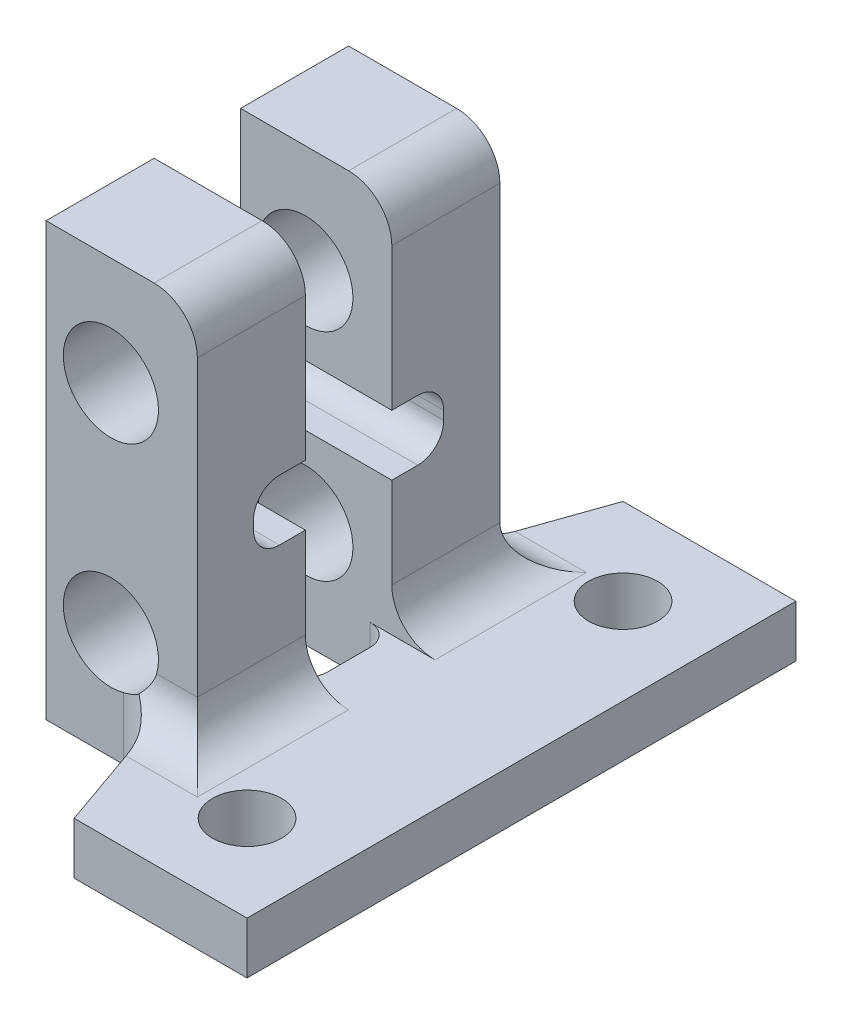
from build123d import *

# Parameters (mm, degrees)
SALIENTE_EXTRUIR1_DEPTH = 5
SALIENTE_EXTRUIR2_DEPTH = 10
SALIENTE_EXTRUIR3_DEPTH = 2
CORTAR_EXTRUIR1_START   = 7
CROQUIS2_R              = 2.2
CORTAR_EXTRUIR1_DEPTH   = 14
CROQUIS3_R              = 1.6
CROQUIS3_W              = 5
CROQUIS3_H              = 4
CROQUIS3_W_2            = 2
CORTAR_EXTRUIR2_DEPTH   = 2.4
REDONDEO1_R             = 2
REDONDEO2_R             = 2
REDONDEO3_R             = 1
REDONDEO4_R             = 1.2


with BuildPart() as part:
    # Croquis1 → Saliente-Extruir1 (new body)
    with BuildSketch(Plane(origin=(0, 0, 0), x_dir=(0, 0, -1), z_dir=(1, 0, 0))):
        Polygon((-12.7, 2.4), (-12.7, 0), (12.7, 0), (12.7, 2.4), (7, 2.4), (7, 20), (2, 20), (2, 11.4), (4.4, 11.4), (4.4, 8.6), (2, 8.6), (2, 2.4), (-2, 2.4), (-2, 8.6), (-4.4, 8.6), (-4.4, 11.4), (-2, 11.4), (-2, 20), (-7, 20), (-7, 2.4), align=None)
    extrude(amount=-SALIENTE_EXTRUIR1_DEPTH)

    # Croquis1<3> → Saliente-Extruir2 (add)
    with BuildSketch(Plane(origin=(0, 0, 0), x_dir=(0, 0, -1), z_dir=(1, 0, 0))):
        Polygon((2, 2.4), (7, 2.4), (12.7, 2.4), (12.7, 0), (-12.7, 0), (-12.7, 2.4), (-7, 2.4), (-2, 2.4), align=None)
    extrude(amount=SALIENTE_EXTRUIR2_DEPTH)

    # Croquis1<4> → Saliente-Extruir3 (add)
    with BuildSketch(Plane(origin=(0, 0, 0), x_dir=(0, 0, -1), z_dir=(1, 0, 0))):
        Polygon((-7, 20), (-7, 2.4), (-2, 2.4), (-2, 8.6), (-4.4, 8.6), (-4.4, 11.4), (-2, 11.4), (-2, 20), align=None)
        Polygon((2, 2.4), (7, 2.4), (7, 20), (2, 20), (2, 11.4), (4.4, 11.4), (4.4, 8.6), (2, 8.6), align=None)
    extrude(amount=SALIENTE_EXTRUIR3_DEPTH)

    # Croquis2 → Cortar-Extruir1 (cut)
    with BuildSketch(Plane.XY.offset(CORTAR_EXTRUIR1_START)):
        with Locations(Location((-2, 15, 0), (0, 0, 270))):
            Circle(CROQUIS2_R)
        with Locations(Location((-2, 5, 0), (0, 0, 270))):
            Circle(CROQUIS2_R)
    extrude(amount=-CORTAR_EXTRUIR1_DEPTH, mode=Mode.SUBTRACT)

    # Croquis3 → Cortar-Extruir2 (cut)
    with BuildSketch(Plane(origin=(0, 0, 0), x_dir=(1, 0, 0), z_dir=(0, 1, 0))):
        Polygon((-5, 7), (0, 7), (2, 12.7), (-5, 12.7), align=None)
        Polygon((2, -12.7), (0, -7), (-5, -7), (-5, -12.7), align=None)
        with Locations(Location((6, -8.7, 0), (0, 0, 90))):
            Circle(CROQUIS3_R)
        with Locations(Location((6, 8.7, 0), (0, 0, 90))):
            Circle(CROQUIS3_R)
        with Locations((-2.5, 0)):
            Rectangle(CROQUIS3_W, CROQUIS3_H)
        with Locations((1, 0)):
            Rectangle(CROQUIS3_W_2, CROQUIS3_H)
    extrude(amount=CORTAR_EXTRUIR2_DEPTH, mode=Mode.SUBTRACT)

    # Redondeo1
    redondeo1_edges = [part.edges().sort_by_distance(p)[0] for p in [
        (2, 20, -4.5),
        (2, 20, 4.5),
    ]]
    fillet(redondeo1_edges, radius=REDONDEO1_R)

    # Redondeo2
    # the kernel refuses this fillet: 2 mm, written as the material it adds along each edge
    with BuildSketch(Plane(origin=(2, 2.4, 3), x_dir=(1, 0, 0), z_dir=(0, 0, -1))) as redondeo2_piece_1_section:
        with BuildLine():
            CenterArc((REDONDEO2_R, -REDONDEO2_R), REDONDEO2_R, 90, 90)
            Line((0, -REDONDEO2_R), (0, 0))
            Line((0, 0), (REDONDEO2_R, 0))
        make_face()
    redondeo2_piece_1 = extrude(amount=15, mode=Mode.PRIVATE)
    redondeo2_piece_1 = split(redondeo2_piece_1, bisect_by=Plane(origin=(2, 2.4, 2), z_dir=(0, 0, 1)), keep=Keep.TOP, mode=Mode.PRIVATE)
    add(redondeo2_piece_1)
    with BuildSketch(Plane(origin=(2, 2.4, -2), x_dir=(1, 0, 0), z_dir=(0, 0, -1))) as redondeo2_piece_2:
        with BuildLine():
            CenterArc((REDONDEO2_R, -REDONDEO2_R), REDONDEO2_R, 90, 90)
            Line((0, -REDONDEO2_R), (0, 0))
            Line((0, 0), (REDONDEO2_R, 0))
        make_face()
    extrude(amount=5)
    with BuildSketch(Plane(origin=(-5, 2.4, -7), x_dir=(0, 0, -1), z_dir=(1, 0, 0))) as redondeo2_piece_3_section:
        with BuildLine():
            CenterArc((REDONDEO2_R, REDONDEO2_R), REDONDEO2_R, 180, 90)
            Line((0, REDONDEO2_R), (0, 0))
            Line((0, 0), (REDONDEO2_R, 0))
        make_face()
    redondeo2_piece_3 = extrude(amount=7, mode=Mode.PRIVATE)
    redondeo2_piece_3 = split(redondeo2_piece_3, bisect_by=Plane(origin=(-0.548095369, 2.4, -5.4379282), z_dir=(0.9435999821328808, 0, 0.331087713029081)), keep=Keep.TOP, mode=Mode.PRIVATE)
    redondeo2_piece_3 = redondeo2_piece_3 - Plane(origin=(-2, 5, -7), x_dir=(0, -1, 0), z_dir=(0, 0, 1)) * Cylinder(2.2, 22, mode=Mode.PRIVATE)
    add(redondeo2_piece_3)
    with BuildSketch(Plane(origin=(2, 2.4, 7), x_dir=(0, 1, 0), z_dir=(-1, 0, 0))) as redondeo2_piece_4_section:
        with BuildLine():
            CenterArc((REDONDEO2_R, -REDONDEO2_R), REDONDEO2_R, 90, 90)
            Line((0, -REDONDEO2_R), (0, 0))
            Line((0, 0), (REDONDEO2_R, 0))
        make_face()
    redondeo2_piece_4 = extrude(amount=7, mode=Mode.PRIVATE)
    redondeo2_piece_4 = split(redondeo2_piece_4, bisect_by=Plane(origin=(0.219238147, 2.4, 7.62482872), z_dir=(0.9435999821328808, 0, -0.331087713029081)), keep=Keep.TOP, mode=Mode.PRIVATE)
    redondeo2_piece_4 = redondeo2_piece_4 - Plane(origin=(-2, 5, 7), x_dir=(0, -1, 0), z_dir=(0, 0, 1)) * Cylinder(2.2, 22, mode=Mode.PRIVATE)
    add(redondeo2_piece_4)
    with BuildSketch(Plane(origin=(0, 0, 7), x_dir=(-1, 0, 0), z_dir=(0, 1, 0))) as redondeo2_piece_5:
        with BuildLine():
            CenterArc((REDONDEO2_R * 0.708893916529, REDONDEO2_R), REDONDEO2_R, 199.334808538, 70.665191462)
            Line((-REDONDEO2_R * 0.234706065604, REDONDEO2_R * 0.668912286971), (0, 0))
            Line((0, 0), (REDONDEO2_R * 0.708893916529, 0))
        make_face()
    extrude(amount=2.4)
    with BuildSketch(Plane(origin=(0, 0, -7), x_dir=(-1, 0, 0), z_dir=(0, 1, 0))) as redondeo2_piece_6:
        with BuildLine():
            CenterArc((REDONDEO2_R * 0.708893916529, -REDONDEO2_R), REDONDEO2_R, 90, 70.665191462)
            Line((-REDONDEO2_R * 0.234706065604, -REDONDEO2_R * 0.668912286971), (0, 0))
            Line((0, 0), (REDONDEO2_R * 0.708893916529, 0))
        make_face()
    extrude(amount=2.4)
    with BuildSketch(Plane(origin=(2, 2.4, 7), x_dir=(0, 1, 0), z_dir=(0, 0, -1))) as redondeo2_piece_7:
        with BuildLine():
            CenterArc((REDONDEO2_R, REDONDEO2_R), REDONDEO2_R, 180, 90)
            Line((0, REDONDEO2_R), (0, 0))
            Line((0, 0), (REDONDEO2_R, 0))
        make_face()
    extrude(amount=5)
    with BuildSketch(Plane(origin=(2, 2.4, 12), x_dir=(0, 1, 0), z_dir=(0, 0, -1))) as redondeo2_piece_8_section:
        with BuildLine():
            CenterArc((REDONDEO2_R, REDONDEO2_R), REDONDEO2_R, 180, 90)
            Line((0, REDONDEO2_R), (0, 0))
            Line((0, 0), (REDONDEO2_R, 0))
        make_face()
    redondeo2_piece_8 = extrude(amount=15, mode=Mode.PRIVATE)
    redondeo2_piece_8 = split(redondeo2_piece_8, bisect_by=Plane(origin=(2, 2.4, -2), z_dir=(0, 0, -1)), keep=Keep.TOP, mode=Mode.PRIVATE)
    add(redondeo2_piece_8)
    with BuildSketch(Plane(origin=(2, 2.4, -2), x_dir=(1, 0, 0), z_dir=(0, 0, -1))) as redondeo2_piece_9a_section:
        with BuildLine():
            CenterArc((REDONDEO2_R, -REDONDEO2_R), REDONDEO2_R, 90, 90)
            Line((0, -REDONDEO2_R), (0, 0))
            Line((0, 0), (REDONDEO2_R, 0))
        make_face()
    redondeo2_piece_9a = extrude(amount=10, mode=Mode.PRIVATE)
    redondeo2_piece_9a = split(redondeo2_piece_9a, bisect_by=Plane(origin=(2, 2.4, -7), z_dir=(0, 0, -1)), keep=Keep.TOP, mode=Mode.PRIVATE)
    with BuildSketch(Plane(origin=(-5, 2.4, -7), x_dir=(0, 0, -1), z_dir=(1, 0, 0))) as redondeo2_piece_9b_section:
        with BuildLine():
            CenterArc((REDONDEO2_R, REDONDEO2_R), REDONDEO2_R, 180, 90)
            Line((0, REDONDEO2_R), (0, 0))
            Line((0, 0), (REDONDEO2_R, 0))
        make_face()
    redondeo2_piece_9b = extrude(amount=12, mode=Mode.PRIVATE)
    redondeo2_piece_9b = split(redondeo2_piece_9b, bisect_by=Plane(origin=(2, 2.4, -7), z_dir=(1, 0, 0)), keep=Keep.TOP, mode=Mode.PRIVATE)
    redondeo2_piece_9b = redondeo2_piece_9b - Plane(origin=(6, 2.4, -8.7), x_dir=(0, 0, -1), z_dir=(0, -1, 0)) * Cylinder(1.6, 32, mode=Mode.PRIVATE)
    redondeo2_piece_9 = redondeo2_piece_9a & redondeo2_piece_9b
    add(redondeo2_piece_9)
    with BuildSketch(Plane(origin=(-5, 2.4, -7), x_dir=(0, 0, -1), z_dir=(1, 0, 0))) as redondeo2_piece_10a_section:
        with BuildLine():
            CenterArc((REDONDEO2_R, REDONDEO2_R), REDONDEO2_R, 180, 90)
            Line((0, REDONDEO2_R), (0, 0))
            Line((0, 0), (REDONDEO2_R, 0))
        make_face()
    redondeo2_piece_10a = extrude(amount=7, mode=Mode.PRIVATE)
    redondeo2_piece_10a = split(redondeo2_piece_10a, bisect_by=Plane(origin=(-0.548095369, 2.4, -5.4379282), z_dir=(-0.9435999821328808, 0, -0.331087713029081)), keep=Keep.TOP, mode=Mode.PRIVATE)
    redondeo2_piece_10a = redondeo2_piece_10a - Plane(origin=(-2, 5, -7), x_dir=(0, -1, 0), z_dir=(0, 0, 1)) * Cylinder(2.2, 22, mode=Mode.PRIVATE)
    with BuildSketch(Plane(origin=(0, 0, -7), x_dir=(-1, 0, 0), z_dir=(0, 1, 0))) as redondeo2_piece_10b_section:
        with BuildLine():
            CenterArc((REDONDEO2_R * 0.708893916529, -REDONDEO2_R), REDONDEO2_R, 90, 70.665191462)
            Line((-REDONDEO2_R * 0.234706065604, -REDONDEO2_R * 0.668912286971), (0, 0))
            Line((0, 0), (REDONDEO2_R * 0.708893916529, 0))
        make_face()
    redondeo2_piece_10b = extrude(amount=5.944469583, mode=Mode.PRIVATE)
    redondeo2_piece_10b = split(redondeo2_piece_10b, bisect_by=Plane(origin=(0, 2.4, -7), z_dir=(0, 1, 0)), keep=Keep.TOP, mode=Mode.PRIVATE)
    redondeo2_piece_10b = redondeo2_piece_10b - Plane(origin=(-2, 5, -7), x_dir=(0, -1, 0), z_dir=(0, 0, 1)) * Cylinder(2.2, 18, mode=Mode.PRIVATE)
    redondeo2_piece_10 = redondeo2_piece_10a & redondeo2_piece_10b
    add(redondeo2_piece_10)
    with BuildSketch(Plane(origin=(7, 2.4, 7), x_dir=(0, 1, 0), z_dir=(-1, 0, 0))) as redondeo2_piece_11a_section:
        with BuildLine():
            CenterArc((REDONDEO2_R, -REDONDEO2_R), REDONDEO2_R, 90, 90)
            Line((0, -REDONDEO2_R), (0, 0))
            Line((0, 0), (REDONDEO2_R, 0))
        make_face()
    redondeo2_piece_11a = extrude(amount=12, mode=Mode.PRIVATE)
    redondeo2_piece_11a = split(redondeo2_piece_11a, bisect_by=Plane(origin=(2, 2.4, 7), z_dir=(1, 0, 0)), keep=Keep.TOP, mode=Mode.PRIVATE)
    redondeo2_piece_11a = redondeo2_piece_11a - Plane(origin=(6, 2.4, 8.7), x_dir=(0, 0, -1), z_dir=(0, -1, 0)) * Cylinder(1.6, 32, mode=Mode.PRIVATE)
    with BuildSketch(Plane(origin=(2, 2.4, 12), x_dir=(0, 1, 0), z_dir=(0, 0, -1))) as redondeo2_piece_11b_section:
        with BuildLine():
            CenterArc((REDONDEO2_R, REDONDEO2_R), REDONDEO2_R, 180, 90)
            Line((0, REDONDEO2_R), (0, 0))
            Line((0, 0), (REDONDEO2_R, 0))
        make_face()
    redondeo2_piece_11b = extrude(amount=10, mode=Mode.PRIVATE)
    redondeo2_piece_11b = split(redondeo2_piece_11b, bisect_by=Plane(origin=(2, 2.4, 7), z_dir=(0, 0, 1)), keep=Keep.TOP, mode=Mode.PRIVATE)
    redondeo2_piece_11 = redondeo2_piece_11a & redondeo2_piece_11b
    add(redondeo2_piece_11)
    with BuildSketch(Plane(origin=(2, 2.4, 7), x_dir=(0, 1, 0), z_dir=(-1, 0, 0))) as redondeo2_piece_12a_section:
        with BuildLine():
            CenterArc((REDONDEO2_R, -REDONDEO2_R), REDONDEO2_R, 90, 90)
            Line((0, -REDONDEO2_R), (0, 0))
            Line((0, 0), (REDONDEO2_R, 0))
        make_face()
    redondeo2_piece_12a = extrude(amount=7, mode=Mode.PRIVATE)
    redondeo2_piece_12a = split(redondeo2_piece_12a, bisect_by=Plane(origin=(0.219238147, 2.4, 7.62482872), z_dir=(-0.9435999821328808, 0, 0.331087713029081)), keep=Keep.TOP, mode=Mode.PRIVATE)
    redondeo2_piece_12a = redondeo2_piece_12a - Plane(origin=(-2, 5, 7), x_dir=(0, -1, 0), z_dir=(0, 0, 1)) * Cylinder(2.2, 22, mode=Mode.PRIVATE)
    with BuildSketch(Plane(origin=(0, 0, 7), x_dir=(-1, 0, 0), z_dir=(0, 1, 0))) as redondeo2_piece_12b_section:
        with BuildLine():
            CenterArc((REDONDEO2_R * 0.708893916529, REDONDEO2_R), REDONDEO2_R, 199.334808538, 70.665191462)
            Line((-REDONDEO2_R * 0.234706065604, REDONDEO2_R * 0.668912286971), (0, 0))
            Line((0, 0), (REDONDEO2_R * 0.708893916529, 0))
        make_face()
    redondeo2_piece_12b = extrude(amount=5.944469583, mode=Mode.PRIVATE)
    redondeo2_piece_12b = split(redondeo2_piece_12b, bisect_by=Plane(origin=(0, 2.4, 7), z_dir=(0, 1, 0)), keep=Keep.TOP, mode=Mode.PRIVATE)
    redondeo2_piece_12b = redondeo2_piece_12b - Plane(origin=(-2, 5, 7), x_dir=(0, -1, 0), z_dir=(0, 0, 1)) * Cylinder(2.2, 18, mode=Mode.PRIVATE)
    redondeo2_piece_12 = redondeo2_piece_12a & redondeo2_piece_12b
    add(redondeo2_piece_12)

    # Redondeo3
    redondeo3_edges = [part.edges().sort_by_distance(p)[0] for p in [
        (2, 1.2, 2),
        (2, 1.2, -2),
    ]]
    fillet(redondeo3_edges, radius=REDONDEO3_R)

    # Redondeo4
    redondeo4_edges = [part.edges().sort_by_distance(p)[0] for p in [
        (-1.5, 11.4, 4.4),
        (-1.5, 8.6, 4.4),
        (-1.5, 8.6, -4.4),
        (-1.5, 11.4, -4.4),
    ]]
    fillet(redondeo4_edges, radius=REDONDEO4_R)


solid = part.part
